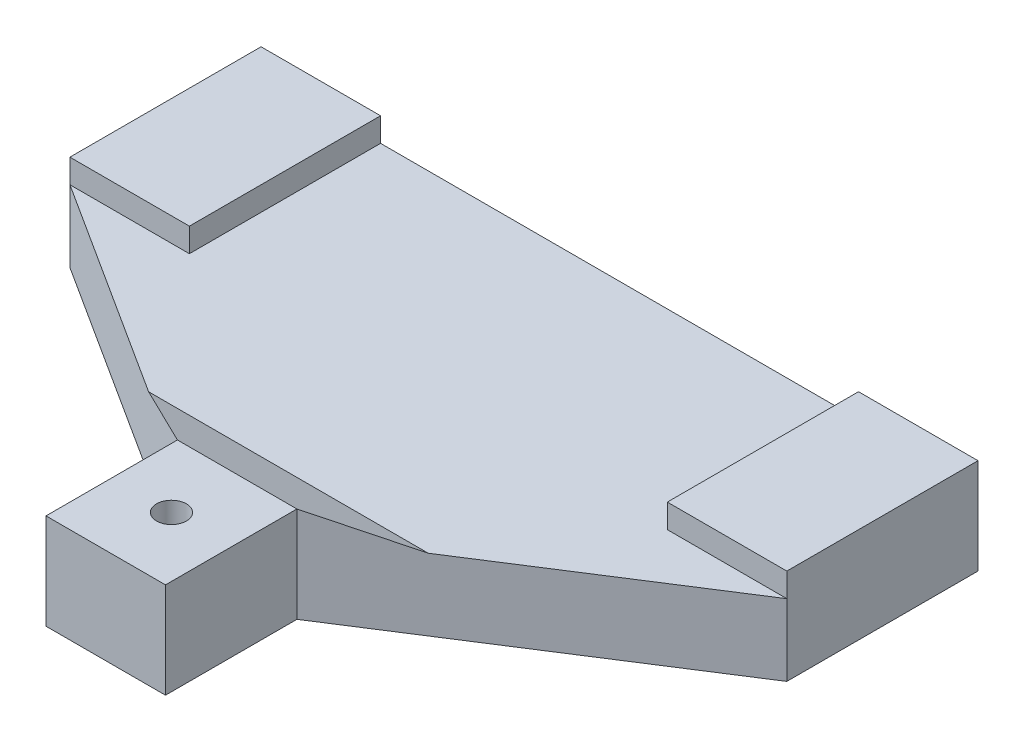
from build123d import *

# Parameters (mm, degrees)
ESQUISSE1_W             = 60
ESQUISSE1_H             = 8
BOSS_EXTRU_1_DEPTH      = 60
ESQUISSE2_R             = 1.25
ENL_V_MAT_EXTRU_1_DEPTH = 15
ESQUISSE3_R             = 1.25
ENL_V_MAT_EXTRU_2_DEPTH = 15
ESQUISSE4_W             = 10
ESQUISSE4_H             = 11
ENL_V_MAT_EXTRU_3_DEPTH = 2
ENL_V_MAT_EXTRU_4_DEPTH = 52
CHANFREIN1_SIZE2        = 4.289013841
CHANFREIN1_SIZE         = 2


with BuildPart() as part:
    # Esquisse1 → Boss.-Extru.1 (new body)
    with BuildSketch(Plane.XY):
        with Locations((30, 4)):
            Rectangle(ESQUISSE1_W, ESQUISSE1_H)
    extrude(amount=BOSS_EXTRU_1_DEPTH)

    # Esquisse2 → Enlèv. mat.-Extru.1 (cut)
    with BuildSketch(Plane(origin=(0, 0, 0), x_dir=(-1, 0, 0), z_dir=(0, 0, -1))):
        with Locations((-54, 4)):
            Circle(ESQUISSE2_R)
        with Locations((-5.75, 4)):
            Circle(ESQUISSE2_R)
    extrude(amount=-ENL_V_MAT_EXTRU_1_DEPTH, mode=Mode.SUBTRACT)

    # Esquisse3 → Enlèv. mat.-Extru.2 (cut)
    with BuildSketch(Plane(origin=(0, 8, 0), x_dir=(1, 0, 0), z_dir=(0, 1, 0))):
        with Locations(Location((30, -37.5, 0), (0, 0, 270))):
            Circle(ESQUISSE3_R)
    extrude(amount=-ENL_V_MAT_EXTRU_2_DEPTH, mode=Mode.SUBTRACT)

    # Esquisse4 → Enlèv. mat.-Extru.3 (cut)
    with BuildSketch(Plane(origin=(0, 8, 0), x_dir=(1, 0, 0), z_dir=(0, 1, 0))):
        Polygon((0, -16), (10, -16), (10, 0), (50, 0), (50, -16), (60, -16), (60, -60), (0, -60), align=None)
        with Locations((30, -37.5)):
            Rectangle(ESQUISSE4_W, ESQUISSE4_H, mode=Mode.SUBTRACT)
    extrude(amount=-ENL_V_MAT_EXTRU_3_DEPTH, mode=Mode.SUBTRACT)

    # Esquisse5 → Enlèv. mat.-Extru.4 (cut)
    with BuildSketch(Plane(origin=(0, 6, 0), x_dir=(1, 0, 0), z_dir=(0, 1, 0))):
        Polygon((60, -16), (35, -32), (35, -43), (25, -43), (25, -32), (0, -16), (-21.594855386, -85.475485762), (75.414479662, -69.930764824), align=None)
    extrude(amount=-ENL_V_MAT_EXTRU_4_DEPTH, mode=Mode.SUBTRACT)

    # Chanfrein1
    chanfrein1_edges = [part.edges().sort_by_distance(p)[0] for p in [
        (30, 6, 32),
    ]]
    chanfrein1_side = [part.faces().sort_by_distance(p)[0] for p in [
        (30, 6.04, 32),
    ]]
    chamfer(chanfrein1_edges, length=CHANFREIN1_SIZE - 0.0001, length2=CHANFREIN1_SIZE2 - 0.0001, reference=chanfrein1_side[0])  # a hair under: the kernel refuses the full size


solid = part.part
